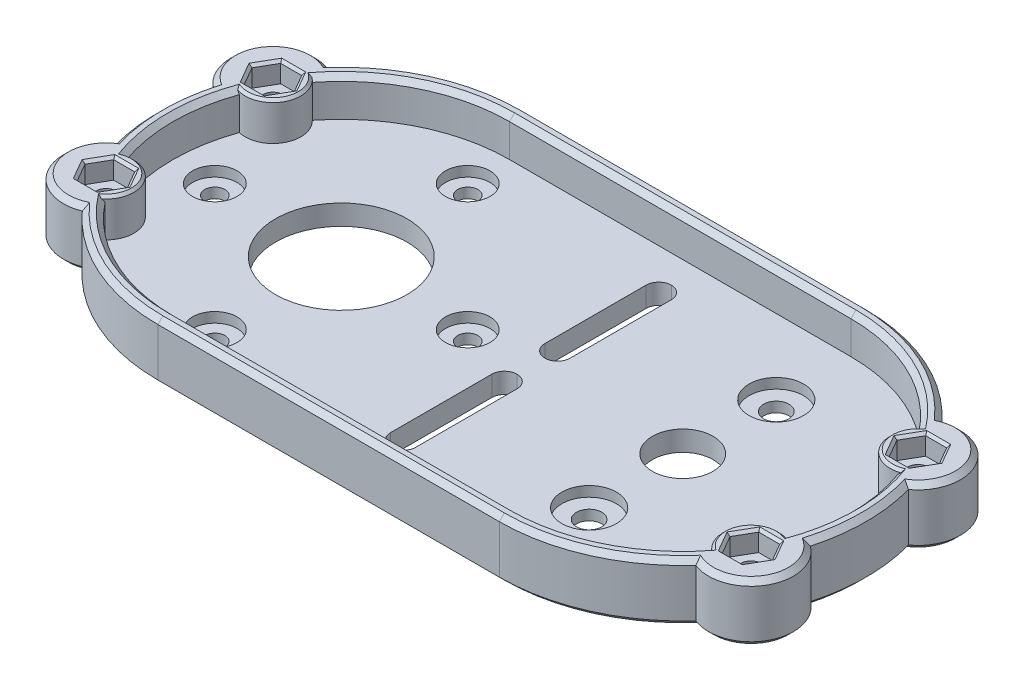
from build123d import *

# Parameters (mm, degrees)
SKETCH1_R           = 13
SKETCH1_R_2         = 2
SKETCH1_R_3         = 6
SKETCH1_R_4         = 2.5
SKETCH1_W           = 5
SKETCH1_H           = 25
BOSS_EXTRUDE1_DEPTH = 4
FILLET1_R           = 2.5
SKETCH2_R           = 5.4
SKETCH2_R_2         = 4.4
CUT_EXTRUDE1_DEPTH  = 2
SKETCH5_R           = 2
BOSS_EXTRUDE2_DEPTH = 7.5
CUT_EXTRUDE2_DEPTH  = 4
CHAMFER1_SIZE       = 1
CHAMFER2_SIZE       = 0.5


with BuildPart() as part:
    # Sketch1 → Boss-Extrude1 (new body)
    with BuildSketch(Plane(origin=(0, 0, 0), x_dir=(1, 0, 0), z_dir=(0, 1, 0))):
        with BuildLine():
            Line((0, 36.25), (67.5, 36.25))
            ThreePointArc((67.5, 36.25), (82.21405629, 33.129428723), (94.394801605, 24.30498193))
            ThreePointArc((94.394801605, 24.30498193), (104.860213633, 20.548117498), (102.428678881, 9.697932337))
            ThreePointArc((102.428678881, 9.697932337), (103.75, 0), (102.428678881, -9.697932337))
            ThreePointArc((102.428678881, -9.697932337), (104.860213633, -20.548117498), (94.394801605, -24.30498193))
            ThreePointArc((94.394801605, -24.30498193), (82.21405629, -33.129428723), (67.5, -36.25))
            Line((67.5, -36.25), (0, -36.25))
            ThreePointArc((0, -36.25), (-14.71405629, -33.129428723), (-26.894801605, -24.30498193))
            ThreePointArc((-26.894801605, -24.30498193), (-37.360213633, -20.548117498), (-34.928678881, -9.697932337))
            ThreePointArc((-34.928678881, -9.697932337), (-36.25, 0), (-34.928678881, 9.697932337))
            ThreePointArc((-34.928678881, 9.697932337), (-37.360213633, 20.548117498), (-26.894801605, 24.30498193))
            ThreePointArc((-26.894801605, 24.30498193), (-14.71405629, 33.129428723), (0, 36.25))
        make_face()
        with Locations(Location((0, 0, 0), (0, 0, 270))):
            Circle(SKETCH1_R, mode=Mode.SUBTRACT)
        with Locations(Location((0, 25, 0), (0, 0, 270))):
            Circle(SKETCH1_R_2, mode=Mode.SUBTRACT)
        with Locations(Location((25, 0, 0), (0, 0, 270))):
            Circle(SKETCH1_R_2, mode=Mode.SUBTRACT)
        with Locations(Location((0, -25, 0), (0, 0, 270))):
            Circle(SKETCH1_R_2, mode=Mode.SUBTRACT)
        with Locations(Location((-25, 0, 0), (0, 0, 270))):
            Circle(SKETCH1_R_2, mode=Mode.SUBTRACT)
        with Locations(Location((67.5, 0, 0), (0, 0, 270))):
            Circle(SKETCH1_R_3, mode=Mode.SUBTRACT)
        with Locations(Location((67.5, 18.5, 0), (0, 0, 270))):
            Circle(SKETCH1_R_4, mode=Mode.SUBTRACT)
        with Locations(Location((67.5, -18.5, 0), (0, 0, 270))):
            Circle(SKETCH1_R_4, mode=Mode.SUBTRACT)
        with Locations(Location((-30, 16.5, 0), (0, 0, 270))):
            Circle(SKETCH1_R_2, mode=Mode.SUBTRACT)
        with Locations(Location((-30, -16.5, 0), (0, 0, 270))):
            Circle(SKETCH1_R_2, mode=Mode.SUBTRACT)
        with Locations(Location((97.5, -16.5, 0), (0, 0, 270))):
            Circle(SKETCH1_R_2, mode=Mode.SUBTRACT)
        with Locations(Location((97.5, 16.5, 0), (0, 0, 270))):
            Circle(SKETCH1_R_2, mode=Mode.SUBTRACT)
        with Locations((37.5, -15.25)):
            Rectangle(SKETCH1_W, SKETCH1_H, mode=Mode.SUBTRACT)
        with Locations((37.5, 15.25)):
            Rectangle(SKETCH1_W, SKETCH1_H, mode=Mode.SUBTRACT)
    extrude(amount=BOSS_EXTRUDE1_DEPTH)

    # Fillet1
    fillet1_edges = [part.edges().sort_by_distance(p)[0] for p in [
        (40, 2, 27.75),
        (35, 2, 27.75),
        (40, 2, 2.75),
        (35, 2, 2.75),
        (35, 2, -2.75),
        (40, 2, -2.75),
        (40, 2, -27.75),
        (35, 2, -27.75),
    ]]
    fillet(fillet1_edges, radius=FILLET1_R - 0.0001)  # a hair under: the kernel refuses the full size

    # Sketch2 → Cut-Extrude1 (cut)
    with BuildSketch(Plane(origin=(0, 4, 0), x_dir=(1, 0, 0), z_dir=(0, 1, 0))):
        with Locations(Location((67.5, 18.5, 0), (0, 0, 270))):
            Circle(SKETCH2_R)
        with Locations(Location((67.5, -18.5, 0), (0, 0, 270))):
            Circle(SKETCH2_R)
        with Locations(Location((0, 25, 0), (0, 0, 270))):
            Circle(SKETCH2_R_2)
        with Locations(Location((25, 0, 0), (0, 0, 270))):
            Circle(SKETCH2_R_2)
        with Locations(Location((-25, 0, 0), (0, 0, 270))):
            Circle(SKETCH2_R_2)
        with Locations(Location((0, -25, 0), (0, 0, 270))):
            Circle(SKETCH2_R_2)
    extrude(amount=-CUT_EXTRUDE1_DEPTH, mode=Mode.SUBTRACT)

    # Sketch5 → Boss-Extrude2 (add)
    with BuildSketch(Plane(origin=(0, 4, 0), x_dir=(1, 0, 0), z_dir=(0, 1, 0))):
        with BuildLine():
            Line((0, 36.25), (67.5, 36.25))
            ThreePointArc((67.5, 36.25), (82.21405629, 33.129428723), (94.394801605, 24.30498193))
            ThreePointArc((94.394801605, 24.30498193), (104.860213633, 20.548117498), (102.428678881, 9.697932337))
            ThreePointArc((102.428678881, 9.697932337), (103.75, 0), (102.428678881, -9.697932337))
            ThreePointArc((102.428678881, -9.697932337), (104.860213633, -20.548117498), (94.394801605, -24.30498193))
            ThreePointArc((94.394801605, -24.30498193), (82.21405629, -33.129428723), (67.5, -36.25))
            Line((67.5, -36.25), (0, -36.25))
            ThreePointArc((0, -36.25), (-14.71405629, -33.129428723), (-26.894801605, -24.30498193))
            ThreePointArc((-26.894801605, -24.30498193), (-37.360213633, -20.548117498), (-34.928678881, -9.697932337))
            ThreePointArc((-34.928678881, -9.697932337), (-36.25, 0), (-34.928678881, 9.697932337))
            ThreePointArc((-34.928678881, 9.697932337), (-37.360213633, 20.548117498), (-26.894801605, 24.30498193))
            ThreePointArc((-26.894801605, 24.30498193), (-14.71405629, 33.129428723), (0, 36.25))
        make_face()
        with Locations(Location((-30, 16.5, 0), (0, 0, 270))):
            Circle(SKETCH5_R, mode=Mode.SUBTRACT)
        with Locations(Location((97.5, 16.5, 0), (0, 0, 270))):
            Circle(SKETCH5_R, mode=Mode.SUBTRACT)
        with Locations(Location((97.5, -16.5, 0), (0, 0, 270))):
            Circle(SKETCH5_R, mode=Mode.SUBTRACT)
        with Locations(Location((-30, -16.5, 0), (0, 0, 270))):
            Circle(SKETCH5_R, mode=Mode.SUBTRACT)
        with BuildLine():
            Line((0, 33.25), (67.5, 33.25))
            ThreePointArc((67.5, 33.25), (82.073642664, 29.885973959), (93.698346174, 20.474597865))
            ThreePointArc((93.698346174, 20.474597865), (92.680812502, 13.849446876), (98.820847684, 11.160958757))
            ThreePointArc((98.820847684, 11.160958757), (100.75, 0), (98.820847684, -11.160958757))
            ThreePointArc((98.820847684, -11.160958757), (92.680812502, -13.849446876), (93.698346174, -20.474597865))
            ThreePointArc((93.698346174, -20.474597865), (82.073642664, -29.885973959), (67.5, -33.25))
            Line((67.5, -33.25), (0, -33.25))
            ThreePointArc((0, -33.25), (-14.573642664, -29.885973959), (-26.198346174, -20.474597865))
            ThreePointArc((-26.198346174, -20.474597865), (-25.180812502, -13.849446876), (-31.320847684, -11.160958757))
            ThreePointArc((-31.320847684, -11.160958757), (-33.25, 0), (-31.320847684, 11.160958757))
            ThreePointArc((-31.320847684, 11.160958757), (-25.180812502, 13.849446876), (-26.198346174, 20.474597865))
            ThreePointArc((-26.198346174, 20.474597865), (-14.573642664, 29.885973959), (0, 33.25))
        make_face(mode=Mode.SUBTRACT)
    extrude(amount=BOSS_EXTRUDE2_DEPTH)

    # Sketch6 → Cut-Extrude2 (cut)
    with BuildSketch(Plane(origin=(0, 11.5, 0), x_dir=(1, 0, 0), z_dir=(0, 1, 0))):
        Polygon((-25.843078062, 16.5), (-27.921539031, 20.1), (-32.078460969, 20.1), (-34.156921938, 16.5), (-32.078460969, 12.9), (-27.921539031, 12.9), align=None)
        Polygon((-34.156921938, -16.5), (-32.078460969, -20.1), (-27.921539031, -20.1), (-25.843078062, -16.5), (-27.921539031, -12.9), (-32.078460969, -12.9), align=None)
        Polygon((101.656921938, 16.5), (99.578460969, 20.1), (95.421539031, 20.1), (93.343078062, 16.5), (95.421539031, 12.9), (99.578460969, 12.9), align=None)
        Polygon((99.578460969, -20.1), (101.656921938, -16.5), (99.578460969, -12.9), (95.421539031, -12.9), (93.343078062, -16.5), (95.421539031, -20.1), align=None)
    extrude(amount=-CUT_EXTRUDE2_DEPTH, mode=Mode.SUBTRACT)

    # Chamfer1
    chamfer1_edges = [part.edges().sort_by_distance(p)[0] for p in [
        (-14.71405629, 0, -33.129428723),
        (33.75, 0, -36.25),
        (82.21405629, 0, -33.129428723),
        (104.860213633, 0, -20.548117498),
        (103.75, 0, 0),
        (104.860213633, 0, 20.548117498),
        (82.21405629, 0, 33.129428723),
        (33.75, 0, 36.25),
        (-14.71405629, 0, 33.129428723),
        (-37.360213633, 0, 20.548117498),
        (-36.25, 0, 0),
        (-37.360213633, 0, -20.548117498),
        (-14.71405629, 11.5, 33.129428723),
        (33.75, 11.5, 36.25),
        (82.21405629, 11.5, 33.129428723),
        (104.860213633, 11.5, 20.548117498),
        (103.75, 11.5, 0),
        (104.860213633, 11.5, -20.548117498),
        (82.21405629, 11.5, -33.129428723),
        (33.75, 11.5, -36.25),
        (-14.71405629, 11.5, -33.129428723),
        (-37.360213633, 11.5, -20.548117498),
        (-36.25, 11.5, 0),
        (-37.360213633, 11.5, 20.548117498),
        (100.75, 11.5, 0),
        (82.073642664, 11.5, -29.885973959),
        (33.75, 11.5, -33.25),
        (-14.573642664, 11.5, -29.885973959),
        (-33.25, 11.5, 0),
        (-14.573642664, 11.5, 29.885973959),
        (33.75, 11.5, 33.25),
        (82.073642664, 11.5, 29.885973959),
    ]]
    chamfer(chamfer1_edges, length=CHAMFER1_SIZE)

    # Chamfer2
    chamfer2_edges = [part.edges().sort_by_distance(p)[0] for p in [
        (-30, 11.5, -12.9),
        (-33.117691454, 11.5, -14.7),
        (-33.117691454, 11.5, -18.3),
        (-30, 11.5, -20.1),
        (-26.882308546, 11.5, -14.7),
        (-26.882308546, 11.5, -18.3),
        (-25.180812502, 11.5, -13.849446876),
        (-30, 11.5, 20.1),
        (-33.117691454, 11.5, 18.3),
        (-33.117691454, 11.5, 14.7),
        (-30, 11.5, 12.9),
        (-26.882308546, 11.5, 18.3),
        (-26.882308546, 11.5, 14.7),
        (-25.180812502, 11.5, 13.849446876),
        (100.617691454, 11.5, 18.3),
        (97.5, 11.5, 20.1),
        (94.382308546, 11.5, 18.3),
        (94.382308546, 11.5, 14.7),
        (97.5, 11.5, 12.9),
        (100.617691454, 11.5, 14.7),
        (92.680812502, 11.5, 13.849446876),
        (92.680812502, 11.5, -13.849446876),
        (97.5, 11.5, -12.9),
        (94.382308546, 11.5, -14.7),
        (94.382308546, 11.5, -18.3),
        (97.5, 11.5, -20.1),
        (100.617691454, 11.5, -14.7),
        (100.617691454, 11.5, -18.3),
    ]]
    chamfer(chamfer2_edges, length=CHAMFER2_SIZE)


solid = part.part
